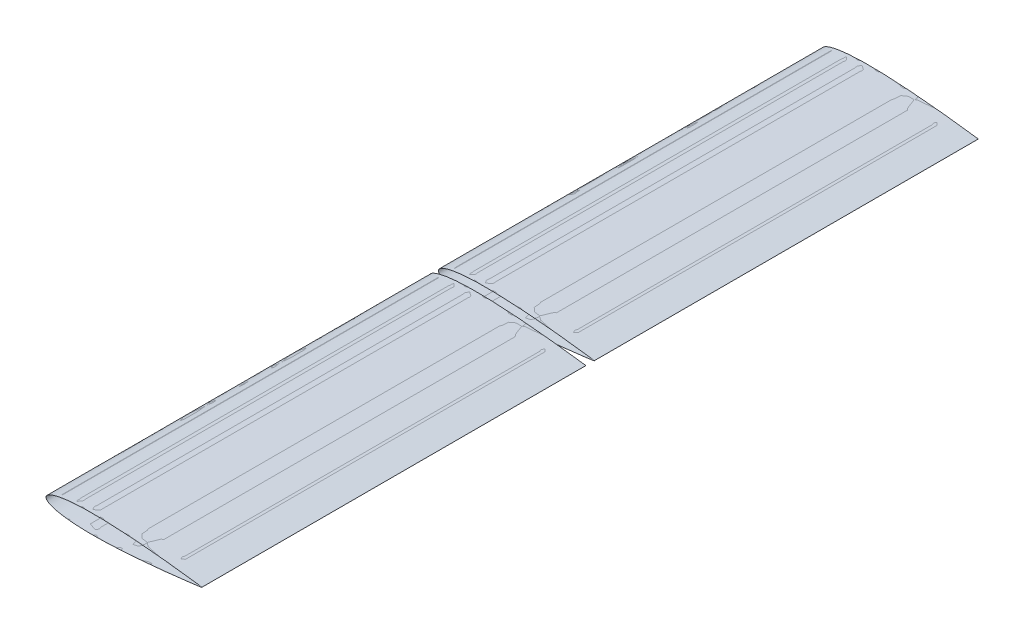
from build123d import *

# Parameters (mm, degrees)
BOSS_EXTRUDE1_START     = -569.976
BOSS_EXTRUDE1_DEPTH     = 1139.952
CUT_EXTRUDE8_DEPTH      = 592.579454814
CUT_EXTRUDE8_DEPTH_BACK = 592.579454814
SKETCH2_W               = 357.236650159
SKETCH2_H               = 12.7


# Read off the part's stored shape, not the designer's step: Boss-Extrude1
with BuildPart() as part:
    # Boss-Extrude1 outline → Boss-Extrude1 (new body)
    with BuildSketch(Plane.XY.offset(BOSS_EXTRUDE1_START)):
        with BuildLine():
            add(Edge.make_bspline(
                [(-72.589557368, 12.491657943), (-72.589557368, 11.868989492), (-72.246632548, 10.62365259), (-71.07536178, 9.158733609), (-69.641718963, 7.997583881), (-67.551731375, 6.722074801), (-64.763344385, 5.477287166), (-61.304511699, 4.299309283), (-57.782929057, 3.336005676), (-53.0377166, 2.261418096), (-47.046222587, 1.221759037), (-39.810155504, 0.30434818), (-32.547991275, -0.362118656), (-25.271211357, -0.829111365), (-15.557941081, -1.23173354), (-3.406745571, -1.389076267), (11.172468704, -1.166356057), (25.742381747, -0.624151651), (40.30001549, 0.171229891), (54.8445738, 1.171561652), (69.37616605, 2.34165562), (81.47531242, 3.43775989), (91.148421908, 4.379384539), (98.400125337, 5.116899063), (105.648651534, 5.884916202), (112.893928065, 6.683021329), (120.135802037, 7.511436102), (126.167727804, 8.227366867), (130.991354533, 8.8159845), (134.608091536, 9.265483891), (138.223794921, 9.723229517), (141.235995666, 10.111710227), (143.645186754, 10.426839796), (145.451795598, 10.665353087), (147.258137034, 10.906078179), (149.064082547, 11.149229942), (150.568971221, 11.353322066), (151.772534312, 11.518400965), (152.674832176, 11.642838925), (153.578654544, 11.764742547), (154.329252506, 11.875340364), (154.929683957, 11.95369008), (155.31103737, 12.001677695), (155.612002314, 12.055245863), (155.785639441, 12.091380585), (155.937479314, 12.075286552), (156.125811298, 12.156934018), (156.194225801, 12.318863259), (156.218550447, 12.491657943), (156.194225801, 12.664452627), (156.125811298, 12.826381868), (155.937479314, 12.908029334), (155.785639441, 12.891935301), (155.612002314, 12.928070023), (155.31103737, 12.981638192), (154.929683957, 13.029625806), (154.329252506, 13.107975522), (153.578654544, 13.218573339), (152.674832176, 13.340476961), (151.772534312, 13.464914921), (150.568971221, 13.629993821), (149.064082547, 13.834085944), (147.258137034, 14.077237707), (145.451795598, 14.317962799), (143.645186754, 14.55647609), (141.235995666, 14.871605659), (138.223794921, 15.260086369), (134.608091536, 15.717831996), (130.991354533, 16.167331386), (126.167727804, 16.755949019), (120.135802037, 17.471879784), (112.893928065, 18.300294557), (105.648651534, 19.098399684), (98.400125337, 19.866416823), (91.148421908, 20.603931347), (81.47531242, 21.545555996), (69.37616605, 22.641660266), (54.8445738, 23.811754234), (40.30001549, 24.812085995), (25.742381747, 25.607467538), (11.172468704, 26.149671943), (-3.406745571, 26.372392153), (-15.557941081, 26.215049426), (-25.271211357, 25.812427251), (-32.547991275, 25.345434542), (-39.810155504, 24.678967706), (-47.046222587, 23.761556849), (-53.0377166, 22.72189779), (-57.782929057, 21.64731021), (-61.304511699, 20.684006603), (-64.763344385, 19.50602872), (-67.551731375, 18.261241085), (-69.641718963, 16.985732005), (-71.07536178, 15.824582277), (-72.246632548, 14.359663296), (-72.589557368, 13.114326394), (-72.589557368, 12.491657943)],
                knots=[0, 0, 0, 0, 0.00390625, 0.0078125, 0.01171875, 0.015625, 0.0234375, 0.03125, 0.0390625, 0.046875, 0.0625, 0.078125, 0.09375, 0.109375, 0.125, 0.15625, 0.1875, 0.21875, 0.25, 0.28125, 0.3125, 0.34375, 0.359375, 0.375, 0.390625, 0.40625, 0.421875, 0.4375, 0.4453125, 0.453125, 0.4609375, 0.46875, 0.47265625, 0.4765625, 0.48046875, 0.484375, 0.48828125, 0.490234375, 0.4921875, 0.494140625, 0.49609375, 0.497070312, 0.498046875, 0.498535156, 0.499023438, 0.499267578, 0.499511719, 0.499755859, 0.5, 0.500244141, 0.500488281, 0.500732422, 0.500976562, 0.501464844, 0.501953125, 0.502929688, 0.50390625, 0.505859375, 0.5078125, 0.509765625, 0.51171875, 0.515625, 0.51953125, 0.5234375, 0.52734375, 0.53125, 0.5390625, 0.546875, 0.5546875, 0.5625, 0.578125, 0.59375, 0.609375, 0.625, 0.640625, 0.65625, 0.6875, 0.71875, 0.75, 0.78125, 0.8125, 0.84375, 0.875, 0.890625, 0.90625, 0.921875, 0.9375, 0.953125, 0.9609375, 0.96875, 0.9765625, 0.984375, 0.98828125, 0.9921875, 0.99609375, 1, 1, 1, 1], degree=3))
        make_face()
        with BuildLine():
            add(Edge.make_bspline(
                [(-72.489557568, 12.491657943), (-72.489557568, 12.163179949), (-72.395425024, 11.48934067), (-71.973228769, 10.512610279), (-71.283304484, 9.572573657), (-70.334027276, 8.665150808), (-69.12846859, 7.787154489), (-67.668383782, 6.937745813), (-65.955909704, 6.117889867), (-63.994082603, 5.32944509), (-61.786794514, 4.574758302), (-59.3387566, 3.85635786), (-56.655356564, 3.176950344), (-53.742685567, 2.539002195), (-50.607371761, 1.945134105), (-47.256663108, 1.397506799), (-43.698292909, 0.898367729), (-39.940537725, 0.449401961), (-35.992130668, 0.052213203), (-31.862278617, -0.292093372), (-27.560604591, -0.582721332), (-23.097129806, -0.819182723), (-18.482275898, -1.001530379), (-13.726817418, -1.130105181), (-8.841852239, -1.205609716), (-3.838777395, -1.229212817), (1.270721946, -1.202325889), (6.474715491, -1.126707188), (11.761052083, -1.004405679), (17.117399344, -0.837746182), (22.531246658, -0.629162896), (27.989948369, -0.381339327), (33.480760297, -0.097088323), (38.990867431, 0.220726476), (44.507403086, 0.569152494), (50.01748413, 0.945227027), (55.50824848, 1.345997345), (60.966870643, 1.768459367), (66.380605649, 2.209786191), (71.736800946, 2.667094899), (77.022966891, 3.137613816), (82.226742233, 3.618637327), (87.335986279, 4.107466038), (92.33874929, 4.601612401), (97.22337044, 5.098509745), (101.97842058, 5.595742135), (106.592806113, 6.09086461), (111.055740441, 6.581468513), (115.356796488, 7.065355622), (119.485946029, 7.540067147), (123.433537168, 8.003395545), (127.190349685, 8.45306443), (130.74759876, 8.88685816), (134.096991185, 9.302502864), (137.230695421, 9.697903027), (140.141398454, 10.07084708), (142.822290249, 10.419416889), (145.267118152, 10.741489308), (147.470194704, 11.035274343), (149.426288026, 11.299112749), (151.131108503, 11.530867321), (152.579838286, 11.730782347), (153.771480415, 11.892674156), (154.69687643, 12.028725239), (155.369349103, 12.105914128), (155.755667825, 12.1894434), (156.151924325, 12.181894561), (156.151924325, 12.801421326), (155.755667825, 12.793872486), (155.369349103, 12.877401758), (154.69687643, 12.954590647), (153.771480415, 13.09064173), (152.579838286, 13.252533539), (151.131108503, 13.452448565), (149.426288026, 13.684203137), (147.470194704, 13.948041543), (145.267118152, 14.241826578), (142.822290249, 14.563898997), (140.141398454, 14.912468806), (137.230695421, 15.285412859), (134.096991185, 15.680813022), (130.74759876, 16.096457726), (127.190349685, 16.530251456), (123.433537168, 16.979920341), (119.485946029, 17.443248739), (115.356796488, 17.917960264), (111.055740441, 18.401847373), (106.592806113, 18.892451276), (101.97842058, 19.387573751), (97.22337044, 19.884806141), (92.33874929, 20.381703485), (87.335986279, 20.875849848), (82.226742233, 21.364678559), (77.022966891, 21.84570207), (71.736800946, 22.316220987), (66.380605649, 22.773529695), (60.966870643, 23.214856519), (55.50824848, 23.637318541), (50.01748413, 24.038088859), (44.507403086, 24.414163392), (38.990867431, 24.762589411), (33.480760297, 25.080404209), (27.989948369, 25.364655213), (22.531246658, 25.612478782), (17.117399344, 25.821062068), (11.761052083, 25.987721565), (6.474715491, 26.110023074), (1.270721946, 26.185641775), (-3.838777395, 26.212528703), (-8.841852239, 26.188925602), (-13.726817418, 26.113421067), (-18.482275898, 25.984846265), (-23.097129806, 25.80249861), (-27.560604591, 25.566037218), (-31.862278617, 25.275409258), (-35.992130668, 24.931102683), (-39.940537725, 24.533913925), (-43.698292909, 24.084948157), (-47.256663108, 23.585809087), (-50.607371761, 23.038181781), (-53.742685567, 22.444313691), (-56.655356564, 21.806365542), (-59.3387566, 21.126958026), (-61.786794514, 20.408557584), (-63.994082603, 19.653870796), (-65.955909704, 18.865426019), (-67.668383782, 18.045570073), (-69.12846859, 17.196161397), (-70.334027276, 16.318165078), (-71.283304484, 15.410742229), (-71.973228769, 14.470705607), (-72.395425024, 13.493975216), (-72.489557568, 12.820135937), (-72.489557568, 12.491657943)],
                knots=[0, 0, 0, 0, 0.002106168, 0.00432059, 0.006772783, 0.009556697, 0.012734041, 0.016342888, 0.020405604, 0.024934102, 0.029933071, 0.035402241, 0.04133743, 0.04773159, 0.054575389, 0.061857405, 0.069564571, 0.077682311, 0.086194684, 0.095084441, 0.104333244, 0.1139217, 0.123829339, 0.134034708, 0.144515531, 0.155248716, 0.166210356, 0.177375783, 0.188719821, 0.200216647, 0.211839951, 0.223562989, 0.235358653, 0.247199625, 0.259058395, 0.270907226, 0.282718457, 0.294464514, 0.306117689, 0.317650771, 0.329036618, 0.34024851, 0.351259999, 0.362045273, 0.372578891, 0.382836142, 0.392792739, 0.40242532, 0.411711115, 0.420628244, 0.429155673, 0.437273179, 0.444961561, 0.452202575, 0.458979063, 0.465274876, 0.471074963, 0.476365569, 0.481133961, 0.485368768, 0.489059784, 0.492198148, 0.494776266, 0.49678801, 0.498228425, 0.499094073, 0.499382862, 0.500617138, 0.500905927, 0.501771575, 0.50321199, 0.505223734, 0.507801852, 0.510940216, 0.514631232, 0.518866039, 0.523634431, 0.528925037, 0.534725124, 0.541020937, 0.547797425, 0.555038439, 0.562726821, 0.570844327, 0.579371756, 0.588288885, 0.59757468, 0.607207261, 0.617163858, 0.627421109, 0.637954727, 0.648740001, 0.65975149, 0.670963382, 0.682349229, 0.693882311, 0.705535486, 0.717281543, 0.729092774, 0.740941605, 0.752800375, 0.764641347, 0.776437011, 0.788160049, 0.799783353, 0.811280179, 0.822624217, 0.833789644, 0.844751284, 0.855484469, 0.865965292, 0.876170661, 0.8860783, 0.895666756, 0.904915559, 0.913805316, 0.922317689, 0.930435429, 0.938142595, 0.945424611, 0.95226841, 0.95866257, 0.964597759, 0.970066929, 0.975065898, 0.979594396, 0.983657112, 0.987265959, 0.990443303, 0.993227217, 0.99567941, 0.997893832, 1, 1, 1, 1], degree=3))
        make_face(mode=Mode.SUBTRACT)
    extrude(amount=BOSS_EXTRUDE1_DEPTH)

    # Sketch2 → Cut-Extrude8 (cut, two sides: drawn at the far end of the back side and taken through both)
    with BuildSketch(Plane(origin=(0, 0, 0), x_dir=(1, 0, 0), z_dir=(0, 1, 0)).offset(-CUT_EXTRUDE8_DEPTH_BACK)):
        with Locations((50.26961401, 0)):
            Rectangle(SKETCH2_W, SKETCH2_H)
    extrude(amount=CUT_EXTRUDE8_DEPTH + CUT_EXTRUDE8_DEPTH_BACK, mode=Mode.SUBTRACT)


with BuildPart() as cut_extrude8_piece_1:
    # of the separate pieces the step leaves, piece 1, a body of its own (cut_extrude8_pieces)
    add(part.part.solids().sort_by_distance((-72.589557368, 12.491657943, 6.35))[0])


with BuildPart() as cut_extrude8_piece_2:
    # of the separate pieces the step leaves, piece 2, a body of its own (cut_extrude8_pieces)
    add(part.part.solids().sort_by_distance((-72.589557368, 12.491657943, -569.976))[0])


solid = Compound([cut_extrude8_piece_1.part, cut_extrude8_piece_2.part])
